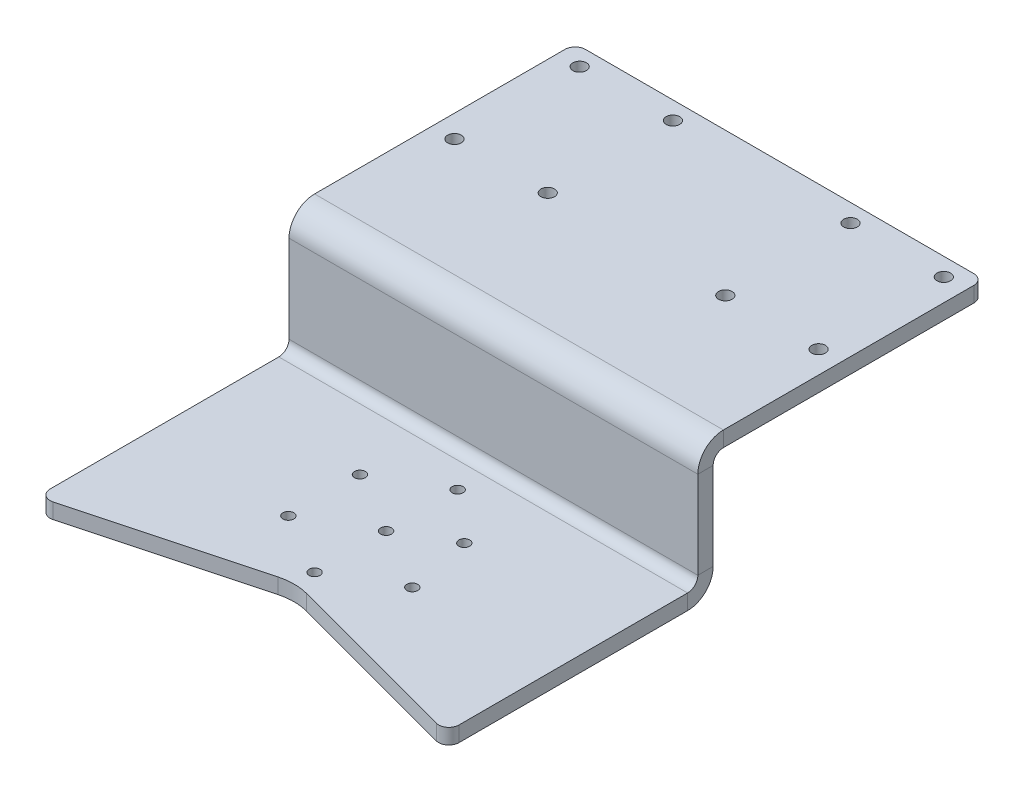
from build123d import *

# Parameters (mm, degrees)
BOSS_EXTRUDE1_DEPTH      = 9.525
SKETCH2_W                = 254
SKETCH2_H                = 9.525
BOSS_EXTRUDE2_DEPTH      = 67.056
SKETCH3_W                = 254
SKETCH3_H                = 9.525
BOSS_EXTRUDE3_DEPTH      = 177.8
CONVERT_SOLID1_START     = -127
CONVERT_SOLID1_DEPTH     = 254
CONVERT_SOLID1_2_DEPTH   = 254
FILLET3_R                = 6.35
F_5_16_CLEARANCE_HOLE1_D = 8.4328
F_1_4_CLEARANCE_HOLE2_D  = 6.7564


# Read off the part's stored shape, not the designer's step: Convert-Solid1
with BuildPart() as part:
    # Sketch1 → Boss-Extrude1 (new body)
    with BuildSketch(Plane(origin=(0, 0, 0), x_dir=(1, 0, 0), z_dir=(0, 1, 0))):
        with BuildLine():
            Line((-127, 76.2), (127, 76.2))
            Line((127, 76.2), (127, -89.969927212))
            Line((127, -89.969927212), (8.874905057, -58.318403417))
            ThreePointArc((8.874905057, -58.318403417), (0, -57.15), (-8.874905057, -58.318403417))
            Line((-8.874905057, -58.318403417), (-127, -89.969927212))
            Line((-127, -89.969927212), (-127, 76.2))
        make_face()
    extrude(amount=BOSS_EXTRUDE1_DEPTH)

    # Sketch2 → Boss-Extrude2 (add)
    with BuildSketch(Plane(origin=(0, 9.525, 0), x_dir=(1, 0, 0), z_dir=(0, 1, 0))):
        with Locations((0, 71.4375)):
            Rectangle(SKETCH2_W, SKETCH2_H)
    extrude(amount=BOSS_EXTRUDE2_DEPTH)

    # Sketch3 → Boss-Extrude3 (add)
    with BuildSketch(Plane.XY.offset(-66.675)):
        with Locations((0, 81.3435)):
            Rectangle(SKETCH3_W, SKETCH3_H)
    extrude(amount=-BOSS_EXTRUDE3_DEPTH)

    # Convert-Solid1 outline → Convert-Solid1 (cut)
    with BuildSketch(Plane.YZ.offset(CONVERT_SOLID1_START)):
        with BuildLine():
            ThreePointArc((70.231, -66.675), (81.456320151, -71.324679849), (86.106, -82.55))
            Line((86.106, -82.55), (86.106, -66.675))
            Line((86.106, -66.675), (70.231, -66.675))
        make_face()
        with BuildLine():
            Line((0, -76.2), (15.875, -76.2))
            ThreePointArc((15.875, -76.2), (4.649679849, -71.550320151), (0, -60.325))
            Line((0, -60.325), (0, -76.2))
        make_face()
    extrude(amount=CONVERT_SOLID1_DEPTH, mode=Mode.SUBTRACT)

    # Convert-Solid1 2 outline → Convert-Solid1 2 (add)
    with BuildSketch(Plane.YZ.offset(CONVERT_SOLID1_START)):
        with BuildLine():
            Line((9.525, -66.675), (15.875, -66.675))
            ThreePointArc((15.875, -66.675), (11.384871939, -64.815128061), (9.525, -60.325))
            Line((9.525, -60.325), (9.525, -66.675))
        make_face()
        with BuildLine():
            ThreePointArc((70.231, -76.2), (74.721128061, -78.059871939), (76.581, -82.55))
            Line((76.581, -82.55), (76.581, -76.2))
            Line((76.581, -76.2), (70.231, -76.2))
        make_face()
    extrude(amount=CONVERT_SOLID1_2_DEPTH)

    # Fillet3
    fillet3_edges = [part.edges().sort_by_distance(p)[0] for p in [
        (127, 4.7625, 89.969927212),
        (-127, 4.7625, 89.969927212),
        (-127, 81.3435, -244.475),
        (127, 81.3435, -244.475),
    ]]
    fillet(fillet3_edges, radius=FILLET3_R)

    # 5/16 Clearance Hole1 (through all)
    with Locations(Plane(origin=(0, 86.106, 0), x_dir=(1, 0, 0), z_dir=(0, 1, 0))):
        with Locations((-113.109375, 233.3625), (-55.165625, 233.3625), (-55.165625, 155.575), (-113.109375, 155.575), (113.109375, 155.575), (55.165625, 155.575), (55.165625, 233.3625), (113.109375, 233.3625)):
            Hole(F_5_16_CLEARANCE_HOLE1_D / 2)

    # 1/4 Clearance Hole2 (through all)
    with Locations(Plane(origin=(0, 9.525, 0), x_dir=(1, 0, 0), z_dir=(0, 1, 0))):
        with Locations((0, 0), (0, 44.45), (30.795863359, 17.78), (38.494829198, -22.225), (0, -44.45), (-38.494829198, -22.225), (-38.494829198, 22.225)):
            Hole(F_1_4_CLEARANCE_HOLE2_D / 2)


solid = part.part
